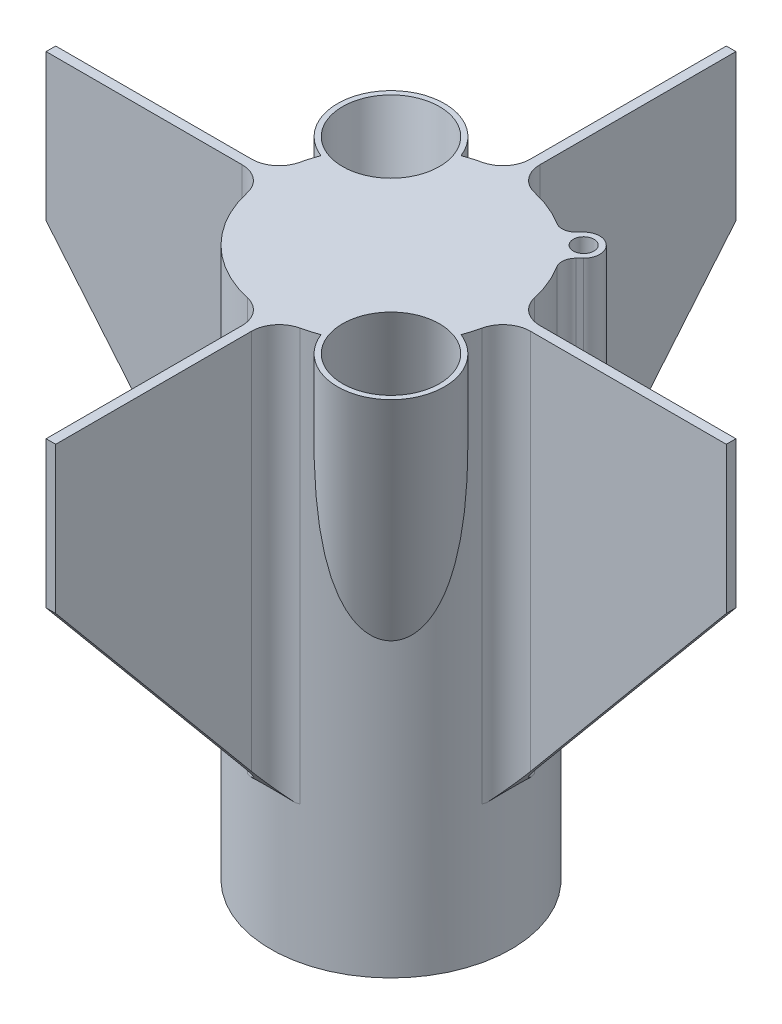
from build123d import *
from build123d.topology import SkipClean

# Parameters (mm, degrees)
SKETCH1_R             = 22.225
SKETCH1_R_2           = 9.05
BOSS_EXTRUDE1_DEPTH   = 63.5
SKETCH2_R             = 11.9
BOSS_EXTRUDE2_DEPTH   = 69.85
BOSS_EXTRUDE3_START   = -2.032
SKETCH5_R             = 22.225
SKETCH5_R_2           = 9.05
BOSS_EXTRUDE3_DEPTH   = 2.032
SKETCH6_R             = 1.5875
BOSS_EXTRUDE4_DEPTH   = 19.05
SKETCH6_2_R           = 1.5875
CUT_EXTRUDE8_DEPTH    = 19.05
BOSS_EXTRUDE5_START   = -76.2
BOSS_EXTRUDE5_DEPTH   = 76.2
CUT_EXTRUDE9_DEPTH    = 97.774416666
BOSS_EXTRUDE6_DEPTH   = 15.875
BOSS_EXTRUDE6_2_DEPTH = 15.875
BOSS_EXTRUDE7_START   = 38.1
SKETCH11_R            = 22.225
SKETCH11_R_2          = 21.175
BOSS_EXTRUDE7_DEPTH   = 38.1
CIRPATTERN2_COUNT     = 4
CIRPATTERN2_2_COUNT   = 4
SKETCH24_R            = 1.905
BOSS_EXTRUDE13_DEPTH  = 50.8
FILLET1_R             = 2.54
CUT_REVOLVE1_ANGLE    = 25.63963
CUT_EXTRUDE10_START   = -3.686202
SKETCH28_R            = 3.175
CUT_EXTRUDE10_DEPTH   = 20.1828
SKETCH30_R            = 21.175
CUT_EXTRUDE11_DEPTH   = 136.005838653
SKETCH34_R            = 21.175
BOSS_EXTRUDE14_DEPTH  = 2.54
BOSS_EXTRUDE16_DEPTH  = 44.45
SKETCH32_R            = 9.11561604
CUT_EXTRUDE12_DEPTH   = 60
SKETCH33_R            = 69.215
CUT_EXTRUDE13_DEPTH   = 136.005838577
BOSS_EXTRUDE18_DEPTH  = 2.54
REVOLVE2_OUTLINE_R    = 1.354380889
REVOLVE2_ANGLE        = 10


# Read off the part's stored shape, not the designer's step: Cut-Revolve1, Revolve2
with BuildPart() as part:
    # Sketch1 → Boss-Extrude1 (new body)
    with BuildSketch(Plane(origin=(0, 0, 0), x_dir=(1, 0, 0), z_dir=(0, 1, 0))):
        with Locations(Location((0, 0, 0), (0, 0, 270))):
            Circle(SKETCH1_R)
        with Locations(Location((0, 0, 0), (0, 0, 270))):
            Circle(SKETCH1_R_2, mode=Mode.SUBTRACT)
        with BuildLine():
            Line((0.5207, 10.077957406), (0.5207, 21.168596942))
            ThreePointArc((0.5207, 21.168596942), (14.972986092, 14.972986092), (21.168596942, 0.5207))
            Line((21.168596942, 0.5207), (10.077957406, 0.5207))
            ThreePointArc((10.077957406, 0.5207), (7.135697372, 7.135697372), (0.5207, 10.077957406))
        make_face(mode=Mode.SUBTRACT)
        with BuildLine():
            Line((-0.5207, 10.077957406), (-0.5207, 21.168596942))
            ThreePointArc((-0.5207, 21.168596942), (-14.972986092, 14.972986092), (-21.168596942, 0.5207))
            Line((-21.168596942, 0.5207), (-10.077957406, 0.5207))
            ThreePointArc((-10.077957406, 0.5207), (-7.135697372, 7.135697372), (-0.5207, 10.077957406))
        make_face(mode=Mode.SUBTRACT)
        with BuildLine():
            Line((10.077957406, -0.5207), (21.168596942, -0.5207))
            ThreePointArc((21.168596942, -0.5207), (14.972986092, -14.972986092), (0.5207, -21.168596942))
            Line((0.5207, -21.168596942), (0.5207, -10.077957406))
            ThreePointArc((0.5207, -10.077957406), (7.135697372, -7.135697372), (10.077957406, -0.5207))
        make_face(mode=Mode.SUBTRACT)
        with BuildLine():
            Line((-0.5207, -10.077957406), (-0.5207, -21.168596942))
            ThreePointArc((-0.5207, -21.168596942), (-14.972986092, -14.972986092), (-21.168596942, -0.5207))
            Line((-21.168596942, -0.5207), (-10.077957406, -0.5207))
            ThreePointArc((-10.077957406, -0.5207), (-7.135697372, -7.135697372), (-0.5207, -10.077957406))
        make_face(mode=Mode.SUBTRACT)
    extrude(amount=BOSS_EXTRUDE1_DEPTH)

    # Sketch5 → Boss-Extrude3 (add)
    with BuildSketch(Plane(origin=(0, 63.5, 0), x_dir=(1, 0, 0), z_dir=(0, 1, 0)).offset(BOSS_EXTRUDE3_START)):
        with Locations(Location((0, 0, 0), (0, 0, 270))):
            Circle(SKETCH5_R)
        with Locations(Location((0, 0, 0), (0, 0, 270))):
            Circle(SKETCH5_R_2, mode=Mode.SUBTRACT)
    extrude(amount=BOSS_EXTRUDE3_DEPTH)

    # Sketch6 → Boss-Extrude4 (add)
    # profile 1 of 2: a face of its own
    with BuildSketch(Plane(origin=(0, 63.5, 0), x_dir=(1, 0, 0), z_dir=(0, 1, 0))):
        with BuildLine():
            Line((9.784809653, 2.468573274), (9.784809653, -2.468573274))
            ThreePointArc((9.784809653, -2.468573274), (14.7904, 0), (9.784809653, 2.468573274))
        make_face()
        with Locations((11.6789, 0)):
            Circle(SKETCH6_R, mode=Mode.SUBTRACT)
    # profile 2 of 2: a face of its own
    with BuildSketch(Plane(origin=(0, 63.5, 0), x_dir=(1, 0, 0), z_dir=(0, 1, 0))):
        with BuildLine():
            Line((-9.784809653, 2.468573274), (-9.784809653, -2.468573274))
            ThreePointArc((-9.784809653, -2.468573274), (-14.7904, 0), (-9.784809653, 2.468573274))
        make_face()
        with Locations((-11.6789, 0)):
            Circle(SKETCH6_R, mode=Mode.SUBTRACT)
    extrude(amount=-BOSS_EXTRUDE4_DEPTH)

    # Sketch6<2> → Cut-Extrude8 (cut)
    with BuildSketch(Plane(origin=(0, 63.5, 0), x_dir=(1, 0, 0), z_dir=(0, 1, 0))):
        with Locations(Location((-11.6789, 0, 0), (0, 0, 270))):
            Circle(SKETCH6_2_R)
        with Locations(Location((11.6789, 0, 0), (0, 0, 270))):
            Circle(SKETCH6_2_R)
    extrude(amount=-CUT_EXTRUDE8_DEPTH, mode=Mode.SUBTRACT)

    # Sketch8 → Boss-Extrude5 (add)
    with BuildSketch(Plane(origin=(0, 63.5, 0), x_dir=(1, 0, 0), z_dir=(0, 1, 0)).offset(BOSS_EXTRUDE5_START)):
        with BuildLine():
            Line((26.644587893, -0.889), (62.865, -0.889))
            Line((62.865, -0.889), (62.865, 0.889))
            Line((62.865, 0.889), (26.644587893, 0.889))
            ThreePointArc((26.644587893, 0.889), (23.469292558, 2.003662746), (21.687455262, 4.858488372))
            ThreePointArc((21.687455262, 4.858488372), (22.225, 0), (21.687455262, -4.858488372))
            ThreePointArc((21.687455262, -4.858488372), (23.469292558, -2.003662746), (26.644587893, -0.889))
        make_face()
    boss_extrude5 = extrude(amount=BOSS_EXTRUDE5_DEPTH)

    # Sketch9 → Cut-Extrude9 (cut, symmetric)
    with BuildSketch(Plane(origin=(0, 0, -0.889), x_dir=(-1, 0, 0), z_dir=(0, 0, -1))):
        Polygon((-21.887063983, -12.7), (-62.865, 36.422254278), (-62.865, -12.7), align=None)
    cut_extrude9 = extrude(amount=CUT_EXTRUDE9_DEPTH, both=True, mode=Mode.SUBTRACT)

    # CirPattern2: Boss-Extrude5 ×4 about axis
    cirpattern2_axis = Axis((0, 0, 0), (0, 1, 0))
    for i in range(1, CIRPATTERN2_COUNT):
        add(boss_extrude5.rotate(cirpattern2_axis, i * 360 / CIRPATTERN2_COUNT))

    # CirPattern2 2: Cut-Extrude9 ×4 about axis
    cirpattern2_2_axis = Axis((0, 0, 0), (0, 1, 0))
    for i in range(1, CIRPATTERN2_2_COUNT):
        add(cut_extrude9.rotate(cirpattern2_2_axis, i * 360 / CIRPATTERN2_2_COUNT), mode=Mode.SUBTRACT)


with BuildPart() as body_2:
    # Sketch2 → Boss-Extrude2 (new body)
    with BuildSketch(Plane.XZ):
        with Locations(Location((0, 0, 0), (0, 0, 270))):
            Circle(SKETCH2_R)
    extrude(amount=-BOSS_EXTRUDE2_DEPTH)


with BuildPart() as body_3:
    # Sketch10 → Boss-Extrude6 (new body)
    with BuildSketch(Plane.XZ):
        with BuildLine():
            Line((6.405198203, 7.798063217), (6.405198203, -7.798063217))
            ThreePointArc((6.405198203, -7.798063217), (10.0914, 0), (6.405198203, 7.798063217))
        make_face()
    extrude(amount=BOSS_EXTRUDE6_DEPTH)


with BuildPart() as body_4:
    # Sketch10 → Boss-Extrude6 2 (new body)
    with BuildSketch(Plane.XZ):
        with BuildLine():
            Line((-6.405198203, 7.798063217), (-6.405198203, -7.798063217))
            ThreePointArc((-6.405198203, -7.798063217), (-10.0914, 0), (-6.405198203, 7.798063217))
        make_face()
    extrude(amount=BOSS_EXTRUDE6_2_DEPTH)

    # Combine3: union body 3, part
    add(body_3.part)
    add(part.part)


with BuildPart() as body_5:
    # Sketch11 → Boss-Extrude7 (new body)
    with BuildSketch(Plane.XZ.offset(BOSS_EXTRUDE7_START)):
        with Locations(Location((0, 0, 0), (0, 0, 90))):
            Circle(SKETCH11_R)
        with Locations(Location((0, 0, 0), (0, 0, 90))):
            Circle(SKETCH11_R_2, mode=Mode.SUBTRACT)
    extrude(amount=-BOSS_EXTRUDE7_DEPTH)

    # Combine4: union body 4
    add(body_4.part)

    # Sketch24 → Boss-Extrude13 (add)
    with SkipClean():  # the faces are left unmerged after this step: merging them gives an invalid solid
        with BuildSketch(Plane(origin=(0, 63.5, 0), x_dir=(1, 0, 0), z_dir=(0, 1, 0))):
            with BuildLine():
                Line((15.715448212, 19.894449289), (13.48641998, 17.665421057))
                ThreePointArc((13.48641998, 17.665421057), (15.715448212, 15.715448212), (17.665421057, 13.48641998))
                Line((17.665421057, 13.48641998), (19.894449289, 15.715448212))
                ThreePointArc((19.894449289, 15.715448212), (19.894449289, 19.894449289), (15.715448212, 19.894449289))
            make_face()
            with Locations(Location((17.80494875, 17.80494875, 0), (0, 0, 270))):
                Circle(SKETCH24_R, mode=Mode.SUBTRACT)
        extrude(amount=-BOSS_EXTRUDE13_DEPTH)

    # Fillet1
    # the kernel refuses this fillet: 2.54 mm, written as the material it adds along each edge
    with BuildSketch(Plane(origin=(17.665421057, 63.5, -13.48641998), x_dir=(0.5702807097884103, 0, 0.8214498840728065), z_dir=(0, -1, 0))) as fillet1_piece_1:
        with BuildLine():
            CenterArc((2.123100743, -2.537406084), FILLET1_R, 92.589617746, 77.180185074)
            Line((-0.376518694, -2.086293381), (0, 0))
            ThreePointArc((0, 0), (1.00416927, -0.022696762), (2.00833854, 0))
        make_face()
    extrude(amount=50.8)
    with BuildSketch(Plane(origin=(13.48641998, 63.5, -17.665421057), x_dir=(-0.8214498840728011, 0, -0.5702807097884178), z_dir=(0, -1, 0))) as fillet1_piece_2:
        with BuildLine():
            CenterArc((2.123100743, 2.537406084), FILLET1_R, 190.23019718, 77.180185074)
            Line((-0.376518694, 2.086293381), (0, 0))
            ThreePointArc((0, 0), (1.00416927, 0.022696762), (2.00833854, 0))
        make_face()
    extrude(amount=50.8)

    # Cut-Revolve1 outline → Cut-Revolve1 (revolve, cut)
    with BuildSketch(Plane(origin=(0, 0, 0), x_dir=(0.8463774031608068, 0, -0.5325836004035134), z_dir=(0.5325836004035134, 0, 0.8463774031608068))):
        Polygon((28.135, 22.936420272), (22.224995946, 12.699992978), (28.135, 12.7), align=None)
    revolve(axis=Axis((0, 0, 0), (0, 1, 0)), revolution_arc=CUT_REVOLVE1_ANGLE, mode=Mode.SUBTRACT)

    # Sketch28 → Cut-Extrude10 (cut)
    with BuildSketch(Plane(origin=(-6.405198203, 0, 0), x_dir=(0, 0, -1), z_dir=(1, 0, 0)).offset(CUT_EXTRUDE10_START)):
        with BuildLine():
            ThreePointArc((0, -15.875), (-4.312339676, -14.90751986), (-7.798063217, -12.19053206))
            Line((-7.798063217, -12.19053206), (-7.798063217, -15.875))
            Line((-7.798063217, -15.875), (0, -15.875))
        make_face()
        with BuildLine():
            ThreePointArc((7.798063217, -12.19053206), (4.312339676, -14.90751986), (0, -15.875))
            Line((0, -15.875), (7.798063217, -15.875))
            Line((7.798063217, -15.875), (7.798063217, -12.19053206))
        make_face()
        with Locations((0, -5.780585399)):
            Circle(SKETCH28_R)
    extrude(amount=CUT_EXTRUDE10_DEPTH, mode=Mode.SUBTRACT)

    # Sketch30 → Cut-Extrude11 (cut, through all)
    with BuildSketch(Plane.XZ.offset(38.1)):
        with Locations(Location((0, 0, 0), (0, 0, 90))):
            Circle(SKETCH30_R)
    extrude(amount=-CUT_EXTRUDE11_DEPTH, mode=Mode.SUBTRACT)

    # Sketch34 → Boss-Extrude14 (add)
    with BuildSketch(Plane(origin=(0, 63.5, 0), x_dir=(1, 0, 0), z_dir=(0, 1, 0))):
        with Locations(Location((0, 0, 0), (0, 0, 270))):
            Circle(SKETCH34_R)
    extrude(amount=-BOSS_EXTRUDE14_DEPTH)

    # Sketch36 → Boss-Extrude16 (add)
    with BuildSketch(Plane.XZ.offset(-60.96)):
        with BuildLine():
            Line((-14.600267945, -15.336648947), (-0.5207, -1.257081002))
            Line((-0.5207, -1.257081002), (-0.5207, -21.168596942))
            ThreePointArc((-0.5207, -21.168596942), (0, -21.175), (0.5207, -21.168596942))
            Line((0.5207, -21.168596942), (0.5207, -0.5207))
            Line((0.5207, -0.5207), (21.168596942, -0.5207))
            ThreePointArc((21.168596942, -0.5207), (21.175, 0), (21.168596942, 0.5207))
            Line((21.168596942, 0.5207), (1.257081002, 0.5207))
            Line((1.257081002, 0.5207), (15.336648947, 14.600267945))
            ThreePointArc((15.336648947, 14.600267945), (14.972986092, 14.972986092), (14.600267945, 15.336648947))
            Line((14.600267945, 15.336648947), (0.5207, 1.257081002))
            Line((0.5207, 1.257081002), (0.5207, 21.168596942))
            ThreePointArc((0.5207, 21.168596942), (0, 21.175), (-0.5207, 21.168596942))
            Line((-0.5207, 21.168596942), (-0.5207, 0.5207))
            Line((-0.5207, 0.5207), (-21.168596942, 0.5207))
            ThreePointArc((-21.168596942, 0.5207), (-21.175, 0), (-21.168596942, -0.5207))
            Line((-21.168596942, -0.5207), (-1.257081002, -0.5207))
            Line((-1.257081002, -0.5207), (-15.336648947, -14.600267945))
            ThreePointArc((-15.336648947, -14.600267945), (-14.972986092, -14.972986092), (-14.600267945, -15.336648947))
        make_face()
    extrude(amount=BOSS_EXTRUDE16_DEPTH)

    # Sketch31 → Revolve1 (revolve)
    with BuildSketch(Plane(origin=(0, 0, 0), x_dir=(0.7071067811865438, 0, 0.7071067811865513), z_dir=(-0.7071067811865513, 0, 0.7071067811865438)), mode=Mode.PRIVATE) as revolve1_sk:
        Polygon((17.765017975, 73.04177716), (2.235875269, 15.086227583), (1.264235841, 15.346577583), (16.723617975, 73.04177716), (16.793378547, 73.30212716), align=None)
    revolve1 = revolve(revolve1_sk.sketch.rotate(Axis((0, -28.224687432, 0), (0.18301270189221636, 0.9659258262890691, 0.1830127018922183)), 315.992972804), axis=Axis((0, -28.224687432, 0), (0.18301270189221636, 0.9659258262890691, 0.1830127018922183)))

    # Sketch32 → Cut-Extrude12 (cut)
    with BuildSketch(Plane(origin=(13.75356266, 72.590160353, 13.75356266), x_dir=(0.9831105486902837, -0.179813649169098, -0.03406905672867654), z_dir=(0.18301270189221638, 0.9659258262890692, 0.18301270189221827))):
        with Locations(Location((5.075184044, -5.254217152, 0), (0, 0, 270))):
            Circle(SKETCH32_R)
    cut_extrude12 = extrude(amount=-CUT_EXTRUDE12_DEPTH, mode=Mode.SUBTRACT)

    # Mirror1: Revolve1, Cut-Extrude12 across plane
    add(revolve1.mirror(Plane(origin=(0, 0, 0), x_dir=(-0.7071067811865512, 0, 0.7071067811865438), z_dir=(0.707106781186544, 0, 0.7071067811865511))))
    add(cut_extrude12.mirror(Plane(origin=(0, 0, 0), x_dir=(-0.7071067811865512, 0, 0.7071067811865438), z_dir=(0.707106781186544, 0, 0.7071067811865511))), mode=Mode.SUBTRACT)

    # Sketch33 → Cut-Extrude13 (cut, through all)
    with BuildSketch(Plane(origin=(0, 63.5, 0), x_dir=(1, 0, 0), z_dir=(0, 1, 0))):
        Circle(SKETCH33_R)
    extrude(amount=CUT_EXTRUDE13_DEPTH, mode=Mode.SUBTRACT)

    # Sketch41 → Boss-Extrude18 (add)
    with BuildSketch(Plane(origin=(-2.772800547, 14.634610776, -2.772800547), x_dir=(0.9831105486902837, 0.17981364916909823, -0.03406905672867657), z_dir=(0.18301270189221655, -0.965925826289069, 0.18301270189221827))):
        with BuildLine():
            Line((-5.920894912, 3.822083246), (4.024972303, -5.784886762))
            ThreePointArc((4.024972303, -5.784886762), (1.257859121, 1.302231586), (-5.920894912, 3.822083246))
        make_face()
    boss_extrude18 = extrude(amount=-BOSS_EXTRUDE18_DEPTH)

    # Mirror2: Boss-Extrude18 across plane
    add(boss_extrude18.mirror(Plane(origin=(0, 0, 0), x_dir=(-0.7071067811865512, 0, 0.7071067811865438), z_dir=(0.707106781186544, 0, 0.7071067811865511))))


with BuildPart() as body_2_2:
    # Revolve2 outline → Revolve2 (revolve)
    with BuildSketch(Plane(origin=(0, 0, 0), x_dir=(-0.7660444431189819, 0, 0.6427876096865347), z_dir=(-0.6427876096865347, 0, -0.7660444431189819))):
        with BuildLine():
            Line((21.117011237, -10.16), (21.117011237, 10.131643161))
            Line((21.117011237, 10.131643161), (17.852055172, 4.476573371))
            ThreePointArc((17.852055172, 4.476573371), (16.648761856, -0.01417842), (17.852055172, -4.50493021))
            Line((17.852055172, -4.50493021), (21.117011237, -10.16))
        make_face()
        with Locations((19.228584454, -0.01417842)):
            Circle(REVOLVE2_OUTLINE_R, mode=Mode.SUBTRACT)
    revolve(axis=Axis((0, 0, 0), (0, 1, 0)), revolution_arc=REVOLVE2_ANGLE)


solid = Compound([body_5.part, body_2_2.part])
